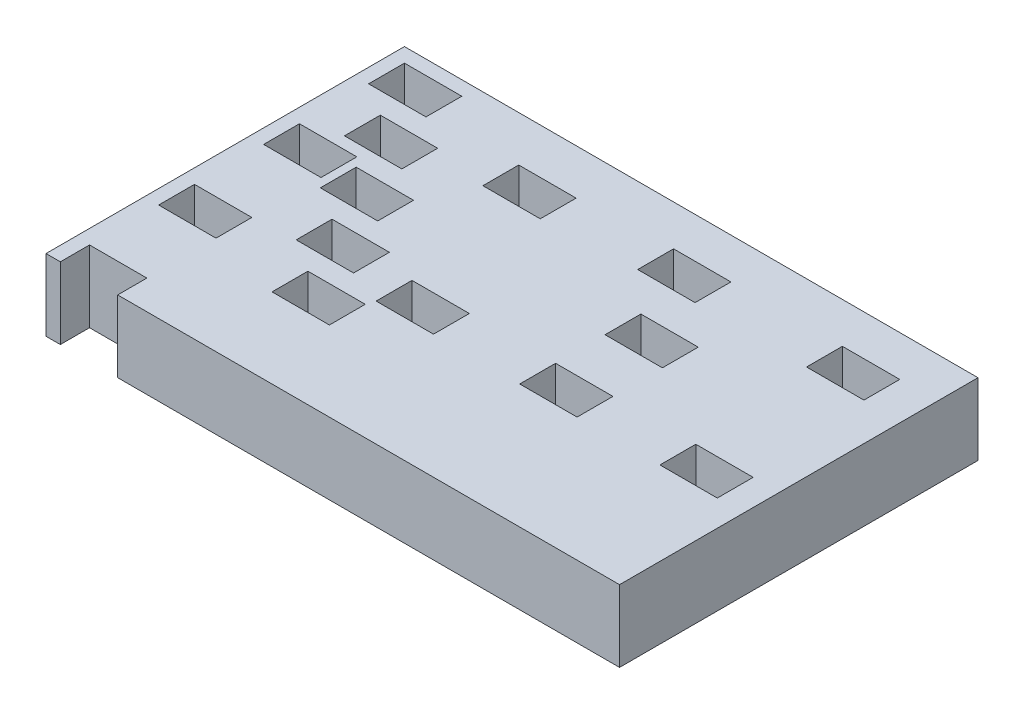
from build123d import *

# Parameters (mm, degrees)
SKETCH1_W               = 80
SKETCH1_H               = 50
BOSS_EXTRUDE1_DEPTH     = 10
SKETCH2_W               = 8
SKETCH2_H               = 5
CUT_EXTRUDE1_DEPTH      = 49.218253805
CRVPATTERN4_START       = -38
CRVPATTERN4_OUTLINE_W   = 10
CRVPATTERN4_OUTLINE_H   = 4.069772856
CRVPATTERN4_OUTLINE_H_2 = 5
CRVPATTERN4_DEPTH       = 8
CRVPATTERN5_COUNT       = 5
CRVPATTERN5_PITCH       = 9.199623468


# Read off the part's stored shape, not the designer's step: CrvPattern4
with BuildPart() as part:
    # Sketch1 → Boss-Extrude1 (new body)
    with BuildSketch(Plane(origin=(0, 0, 0), x_dir=(1, 0, 0), z_dir=(0, 1, 0))):
        Rectangle(SKETCH1_W, SKETCH1_H)
    extrude(amount=BOSS_EXTRUDE1_DEPTH)

    # Sketch2 → Cut-Extrude1 (cut, through all)
    with BuildSketch(Plane(origin=(0, 10, 0), x_dir=(1, 0, 0), z_dir=(0, 1, 0))):
        with Locations((-34, 20.5)):
            Rectangle(SKETCH2_W, SKETCH2_H)
    cut_extrude1 = extrude(amount=-CUT_EXTRUDE1_DEPTH, mode=Mode.SUBTRACT)

    # CrvPattern4 outline → CrvPattern4 (cut)
    with BuildSketch(Plane.YZ.offset(CRVPATTERN4_START)):
        with Locations((5, 22.965113572)):
            Rectangle(CRVPATTERN4_OUTLINE_W, CRVPATTERN4_OUTLINE_H)
        with Locations((5, 8.786818096)):
            Rectangle(CRVPATTERN4_OUTLINE_W, CRVPATTERN4_OUTLINE_H_2)
        with Locations((5, -5.856590952)):
            Rectangle(CRVPATTERN4_OUTLINE_W, CRVPATTERN4_OUTLINE_H_2)
    extrude(amount=CRVPATTERN4_DEPTH, mode=Mode.SUBTRACT)

    # CrvPattern5: Cut-Extrude1 ×5
    with Locations(*[Vector(0.4999999999066592, 0, 0.866025403838329) * (i * CRVPATTERN5_PITCH) for i in range(1, CRVPATTERN5_COUNT)]):
        add(cut_extrude1, mode=Mode.SUBTRACT)

    # Sketch-Pattern1: Cut-Extrude1 at 7 more places
    with Locations((20.278987, 0, 4.33593), (41.199189, 0, 3.664318), (64.749753, 0, 3.664318), (66.35627, 0, 25.718932), (46.79827, 0, 25.718932), (26.76839, 0, 25.718932), (46.79827, 0, 13.819596)):
        add(cut_extrude1, mode=Mode.SUBTRACT)


solid = part.part
